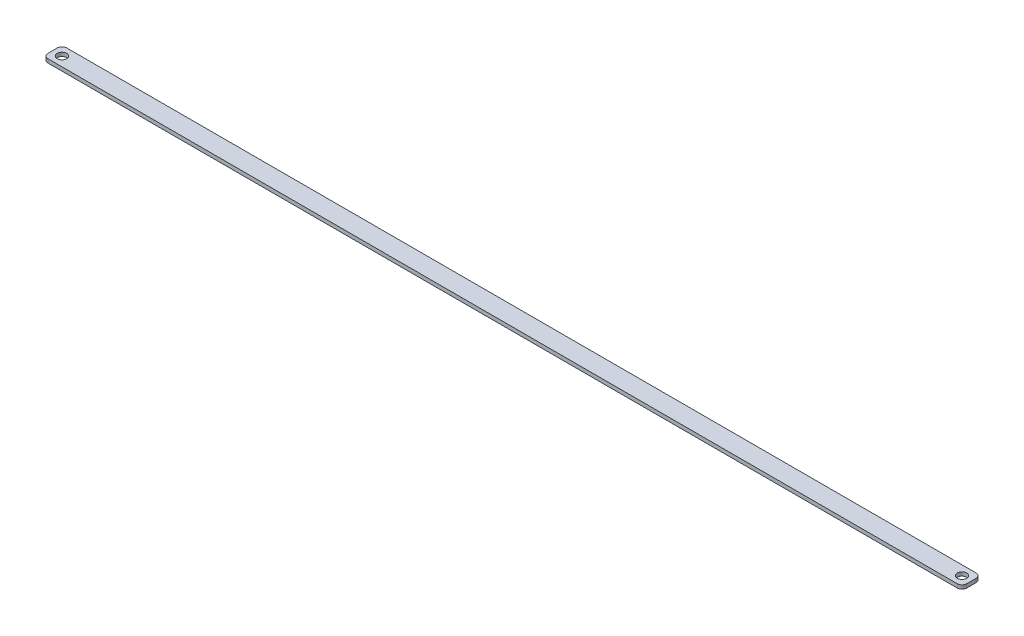
from build123d import *

# Parameters (mm, degrees)
SKETCH1_R           = 2.5
BOSS_EXTRUDE2_DEPTH = 2
FLEX1_OUTLINE_R     = 2.5
FLEX1_DEPTH         = 2


# Read off the part's stored shape, not the designer's step: Flex1
with BuildPart() as part:
    # Sketch1 → Boss-Extrude2 (new body)
    with BuildSketch(Plane(origin=(0, 0, 0), x_dir=(1, 0, 0), z_dir=(0, 1, 0))):
        with BuildLine():
            Line((2.5, 0), (47.5, 0))
            ThreePointArc((47.5, 0), (49.267766953, 0.732233047), (50, 2.5))
            Line((50, 2.5), (50, 7.5))
            ThreePointArc((50, 7.5), (49.267766953, 9.267766953), (47.5, 10))
            Line((47.5, 10), (2.5, 10))
            ThreePointArc((2.5, 10), (0.732233047, 9.267766953), (0, 7.5))
            Line((0, 7.5), (0, 2.5))
            ThreePointArc((0, 2.5), (0.732233047, 0.732233047), (2.5, 0))
        make_face()
        with Locations(Location((5, 5, 0), (0, 0, 270))):
            Circle(SKETCH1_R, mode=Mode.SUBTRACT)
        with Locations(Location((45, 5, 0), (0, 0, 270))):
            Circle(SKETCH1_R, mode=Mode.SUBTRACT)
    extrude(amount=BOSS_EXTRUDE2_DEPTH)

    # Flex1 outline → Flex1 (add)
    # profile 1 of 4: a face of its own
    with BuildSketch(Plane(origin=(0, 0, 0), x_dir=(1, 0, 0), z_dir=(0, 1, 0))):
        with BuildLine():
            Line((2.5, 10), (-212.187046933, 10))
            ThreePointArc((-212.187046933, 10), (-213.954813886, 9.267766953), (-214.687046933, 7.5))
            Line((-214.687046933, 7.5), (-214.687046933, 2.5))
            ThreePointArc((-214.687046933, 2.5), (-213.954813886, 0.732233047), (-212.187046933, 0))
            Line((-212.187046933, 0), (2.5, 0))
            ThreePointArc((2.5, 0), (0.732233047, 0.732233047), (0, 2.5))
            Line((0, 2.5), (0, 7.5))
            ThreePointArc((0, 7.5), (0.732233047, 9.267766953), (2.5, 10))
        make_face()
        with Locations((-209.687046933, 5)):
            Circle(FLEX1_OUTLINE_R, mode=Mode.SUBTRACT)
    # profile 2 of 4: a face of its own
    with BuildSketch(Plane(origin=(0, 0, 0), x_dir=(1, 0, 0), z_dir=(0, 1, 0))):
        with BuildLine():
            Line((272.812953067, 10), (47.5, 10))
            ThreePointArc((47.5, 10), (49.267766953, 9.267766953), (50, 7.5))
            Line((50, 7.5), (50, 2.5))
            ThreePointArc((50, 2.5), (49.267766953, 0.732233047), (47.5, 0))
            Line((47.5, 0), (272.812953067, 0))
            ThreePointArc((272.812953067, 0), (274.58072002, 0.732233047), (275.312953067, 2.5))
            Line((275.312953067, 2.5), (275.312953067, 7.5))
            ThreePointArc((275.312953067, 7.5), (274.58072002, 9.267766953), (272.812953067, 10))
        make_face()
        with Locations((270.312953067, 5)):
            Circle(FLEX1_OUTLINE_R, mode=Mode.SUBTRACT)
    # profile 3 of 4: a face of its own
    with BuildSketch(Plane(origin=(0, 0, 0), x_dir=(1, 0, 0), z_dir=(0, 1, 0))):
        with Locations((5, 5)):
            Circle(FLEX1_OUTLINE_R)
    # profile 4 of 4: a face of its own
    with BuildSketch(Plane(origin=(0, 0, 0), x_dir=(1, 0, 0), z_dir=(0, 1, 0))):
        with Locations((45, 5)):
            Circle(FLEX1_OUTLINE_R)
    extrude(amount=FLEX1_DEPTH)


solid = part.part
